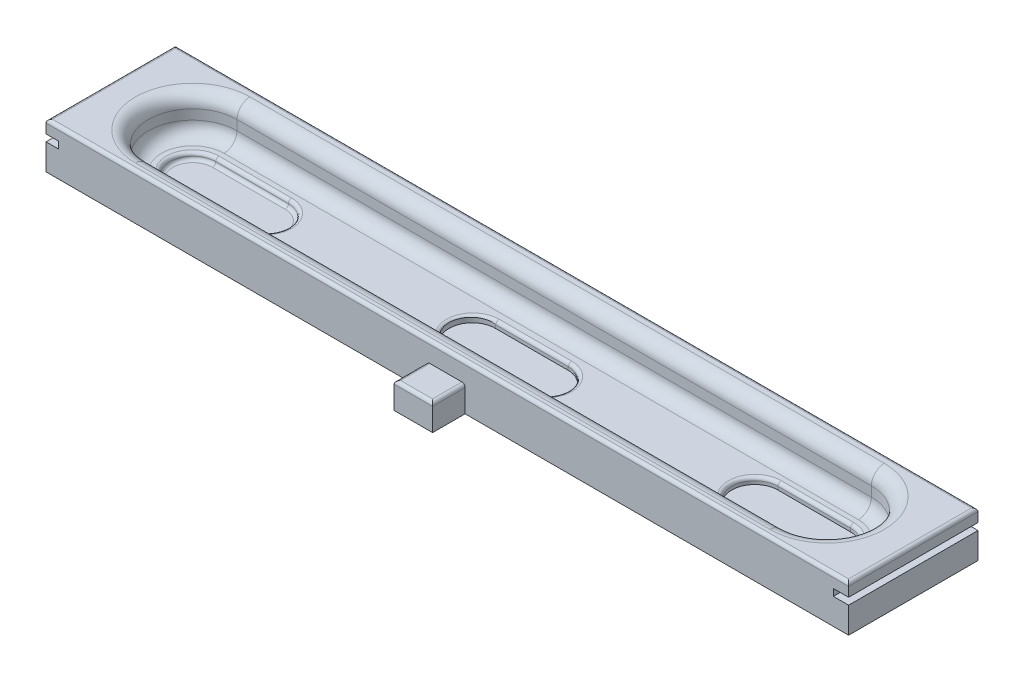
from build123d import *

# Parameters (mm, degrees)
SKETCH1_W           = 246.5
SKETCH1_H           = 39.733186143
BOSS_EXTRUDE1_DEPTH = 14
SKETCH2_W           = 4.694067914
SKETCH2_H           = 2.1
CUT_EXTRUDE1_DEPTH  = 251.853556912
CUT_EXTRUDE3_DEPTH  = 11
FILLET2_R           = 4
CUT_EXTRUDE4_DEPTH  = 2
FILLET6_R           = 1
FILLET8_R           = 1
SKETCH7_W           = 11.788952715
SKETCH7_H           = 7.980899871
BOSS_EXTRUDE2_DEPTH = 10
FILLET7_R           = 1


with BuildPart() as part:
    # Sketch1 → Boss-Extrude1 (new body)
    with BuildSketch(Plane(origin=(0, 0, 0), x_dir=(1, 0, 0), z_dir=(0, 1, 0))):
        with Locations((124.040883242, -8.453184467)):
            Rectangle(SKETCH1_W, SKETCH1_H)
    extrude(amount=BOSS_EXTRUDE1_DEPTH)

    # Sketch2 → Cut-Extrude1 (cut, through all)
    with BuildSketch(Plane.XY.offset(28.319777539)):
        with Locations((2.347033957, 9.05)):
            Rectangle(SKETCH2_W, SKETCH2_H)
    cut_extrude1 = extrude(amount=-CUT_EXTRUDE1_DEPTH, mode=Mode.SUBTRACT)

    # Sketch5 → Cut-Extrude3 (cut)
    with BuildSketch(Plane(origin=(0, 14, 0), x_dir=(1, 0, 0), z_dir=(0, 1, 0))):
        with BuildLine():
            Line((26.177280041, 4.946524414), (221.051198354, 4.907326306))
            ThreePointArc((221.051198354, 4.907326306), (234.637134771, -8.684076724), (221.045731741, -22.270013142))
            Line((221.045731741, -22.270013142), (26.171813428, -22.230815033))
            ThreePointArc((26.171813428, -22.230815033), (12.585877011, -8.639412003), (26.177280041, 4.946524414))
        make_face()
    extrude(amount=-CUT_EXTRUDE3_DEPTH, mode=Mode.SUBTRACT)

    # Fillet2
    fillet2_edges = [part.edges().sort_by_distance(p)[0] for p in [
        (12.585877011, 3, 8.639412003),
        (123.614239198, 3, -4.92692536),
        (234.637134771, 3, 8.684076724),
        (123.608772585, 3, 22.250414087),
        (12.585877011, 14, 8.639412003),
        (123.608772585, 14, 22.250414087),
        (234.637134771, 14, 8.684076724),
        (123.614239198, 14, -4.92692536),
    ]]
    fillet(fillet2_edges, radius=FILLET2_R)

    # Sketch6 → Cut-Extrude4 (cut)
    with BuildSketch(Plane(origin=(0, 3, 0), x_dir=(1, 0, 0), z_dir=(0, 1, 0))):
        with BuildLine():
            Line((26.174546735, -1.544173788), (48.474546735, -1.544173788))
            ThreePointArc((48.474546735, -1.544173788), (55.572518256, -8.64214531), (48.474546735, -15.740116831))
            Line((48.474546735, -15.740116831), (26.174546735, -15.740116831))
            ThreePointArc((26.174546735, -15.740116831), (19.076575213, -8.64214531), (26.174546735, -1.544173788))
        make_face()
        with BuildLine():
            Line((112.578301419, -1.927776302), (134.878301419, -1.927776302))
            ThreePointArc((134.878301419, -1.927776302), (141.97627294, -9.025747823), (134.878301419, -16.123719344))
            Line((134.878301419, -16.123719344), (112.578301419, -16.123719344))
            ThreePointArc((112.578301419, -16.123719344), (105.480329898, -9.025747823), (112.578301419, -1.927776302))
        make_face()
    cut_extrude4 = extrude(amount=-CUT_EXTRUDE4_DEPTH, mode=Mode.SUBTRACT)

    # Fillet6
    fillet6_edges = [part.edges().sort_by_distance(p)[0] for p in [
        (19.076575213, 3, 8.64214531),
        (37.324546735, 3, 1.544173788),
        (55.572518256, 3, 8.64214531),
        (37.324546735, 3, 15.740116831),
        (37.324546735, 1, 1.544173788),
        (55.572518256, 1, 8.64214531),
        (37.324546735, 1, 15.740116831),
        (19.076575213, 1, 8.64214531),
        (105.480329898, 3, 9.025747823),
        (123.728301419, 3, 1.927776302),
        (141.97627294, 3, 9.025747823),
        (123.728301419, 3, 16.123719344),
        (123.728301419, 1, 1.927776302),
        (141.97627294, 1, 9.025747823),
        (123.728301419, 1, 16.123719344),
        (105.480329898, 1, 9.025747823),
    ]]
    fillet(fillet6_edges, radius=FILLET6_R - 0.0001)  # a hair under: the kernel refuses the full size

    # Mirror4: Cut-Extrude4 across plane
    add(cut_extrude4.mirror(Plane(origin=(123.647335387, 0, 0), x_dir=(0, 0, 1), z_dir=(1, 0, 0))), mode=Mode.SUBTRACT)

    # Fillet8
    fillet8_edges = [part.edges().sort_by_distance(p)[0] for p in [
        (228.218095561, 3, 8.64214531),
        (209.97012404, 3, 15.740116831),
        (191.722152519, 3, 8.64214531),
        (209.97012404, 3, 1.544173788),
    ]]
    fillet(fillet8_edges, radius=FILLET8_R)

    # Mirror5: Cut-Extrude1 across plane
    add(cut_extrude1.mirror(Plane(origin=(123.647335387, 0, 0), x_dir=(0, 0, 1), z_dir=(1, 0, 0))), mode=Mode.SUBTRACT)

    # Sketch7 → Boss-Extrude2 (add)
    with BuildSketch(Plane.XY.offset(28.319777539)):
        with Locations((123.619253178, 3.990449936)):
            Rectangle(SKETCH7_W, SKETCH7_H)
    extrude(amount=BOSS_EXTRUDE2_DEPTH)

    # Fillet7
    fillet7_edges = [part.edges().sort_by_distance(p)[0] for p in [
        (0.790883242, 14, 8.453184468),
        (124.040883242, 14, 28.319777539),
        (129.513729535, 7.980899871, 33.319777539),
        (117.72477682, 7.980899871, 33.319777539),
        (123.619253178, 7.980899871, 38.319777539),
        (247.290883242, 14, 8.453184468),
        (124.040883242, 14, -11.413408604),
    ]]
    fillet(fillet7_edges, radius=FILLET7_R)


solid = part.part
